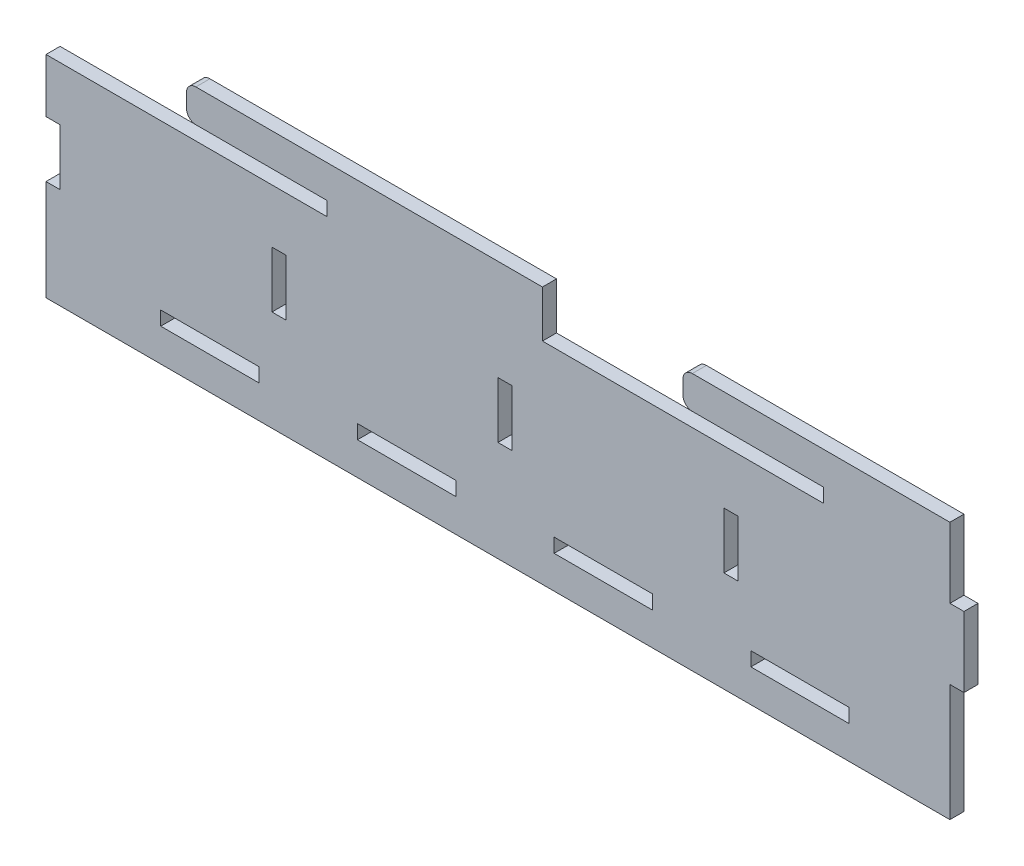
from build123d import *

# Parameters (mm, degrees)
SKETCH1_W           = 21
SKETCH1_H           = 3
SKETCH1_W_2         = 3
SKETCH1_H_2         = 12
BOSS_EXTRUDE1_DEPTH = 3
FILLET1_R           = 2


with BuildPart() as part:
    # Sketch1 → Boss-Extrude1 (new body)
    with BuildSketch(Plane.XY):
        Polygon((-99.454545455, -7.25), (-102.454545455, -7.25), (-102.454545455, -28.75), (90.545454545, -28.75), (90.545454545, -3.75), (93.545454545, -3.75), (93.545454545, 11.25), (90.545454545, 11.25), (90.545454545, 26.25), (33.545454545, 26.25), (33.545454545, 19.25), (63.545454545, 19.25), (63.545454545, 16.25), (3.545454545, 16.25), (3.545454545, 26.25), (-72.454545455, 26.25), (-72.454545455, 19.25), (-42.454545455, 19.25), (-42.454545455, 16.25), (-102.454545455, 16.25), (-102.454545455, 4.75), (-99.454545455, 4.75), align=None)
        with Locations((-67.454545455, -20.25)):
            Rectangle(SKETCH1_W, SKETCH1_H, mode=Mode.SUBTRACT)
        with Locations((-25.454545455, -20.25)):
            Rectangle(SKETCH1_W, SKETCH1_H, mode=Mode.SUBTRACT)
        with Locations((16.545454545, -20.25)):
            Rectangle(SKETCH1_W, SKETCH1_H, mode=Mode.SUBTRACT)
        with Locations((58.545454545, -20.25)):
            Rectangle(SKETCH1_W, SKETCH1_H, mode=Mode.SUBTRACT)
        with Locations((-52.704545455, -1.25)):
            Rectangle(SKETCH1_W_2, SKETCH1_H_2, mode=Mode.SUBTRACT)
        with Locations((-4.454545455, -1.25)):
            Rectangle(SKETCH1_W_2, SKETCH1_H_2, mode=Mode.SUBTRACT)
        with Locations((43.795454545, -1.25)):
            Rectangle(SKETCH1_W_2, SKETCH1_H_2, mode=Mode.SUBTRACT)
    extrude(amount=BOSS_EXTRUDE1_DEPTH)

    # Fillet1
    fillet1_edges = [part.edges().sort_by_distance(p)[0] for p in [
        (33.545454545, 19.25, 1.5),
        (33.545454545, 26.25, 1.5),
        (-72.454545455, 19.25, 1.5),
        (-72.454545455, 26.25, 1.5),
    ]]
    fillet(fillet1_edges, radius=FILLET1_R)


solid = part.part
